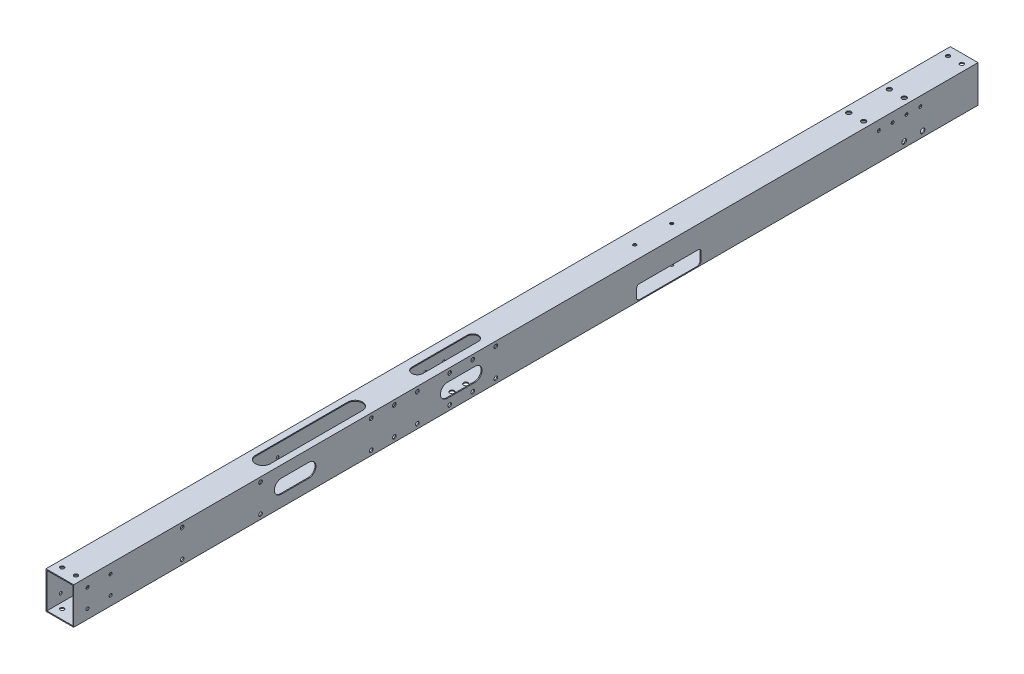
from build123d import *

# Parameters (mm, degrees)
SKETCH_1_W             = 30
SKETCH_1_H             = 40
SKETCH_1_W_2           = 28
SKETCH_1_H_2           = 38
EXTRUDE_1_DEPTH        = 940
SKETCH_5_R             = 2.5
CUT_EXTRUDE_3_DEPTH    = 941.97024395
CUT_EXTRUDE_4_DEPTH    = 1
SKETCH_7_R             = 1.5
CUT_EXTRUDE_5_DEPTH    = 1
SKETCH_17_W            = 30
SKETCH_17_H            = 40
SKETCH_17_W_2          = 28
SKETCH_17_H_2          = 38
EXTRUDE_2_DEPTH        = 20
SKETCH_18_W            = 30
SKETCH_18_H            = 40
SKETCH_18_W_2          = 28
SKETCH_18_H_2          = 38
EXTRUDE_3_DEPTH        = 20
SKETCH_19_R            = 2.1
CUT_EXTRUDE_16_DEPTH   = 961.950050731
SKETCH_20_R            = 1.6
CUT_EXTRUDE_17_DEPTH   = 961.67684473
SKETCH_21_R            = 2.5
SKETCH_21_R_2          = 1.6
CUT_EXTRUDE_18_DEPTH   = 961.67684473
SKETCH_23_R            = 2.5
CUT_EXTRUDE_19_DEPTH   = 961.950050731
SKETCH_24_R            = 4.5
CUT_EXTRUDE_20_DEPTH   = 10
SKETCH_26_R            = 2
CUT_EXTRUDE_22_DEPTH   = 961.67684473
CUT_EXTRUDE_28_DEPTH   = 10
PATTERN_LINEAR_4_COUNT = 2
PATTERN_LINEAR_4_PITCH = 255
PATTERN_LINEAR_8_COUNT = 2
PATTERN_LINEAR_8_PITCH = 205
PATTERN_LINEAR_9_COUNT = 2
PATTERN_LINEAR_9_PITCH = 230
CUT_EXTRUDE_START      = -20
SKETCH_34_R            = 1.75
CUT_EXTRUDE_29_DEPTH   = 20
SKETCH_35_R            = 1.5
CUT_EXTRUDE_30_DEPTH   = 10
CUT_EXTRUDE_31_DEPTH   = 10
SKETCH_37_R            = 1.65
CUT_EXTRUDE_32_DEPTH   = 52
SKETCH_39_R            = 1.75
CUT_EXTRUDE_33_DEPTH   = 10
SKETCH_40_W            = 70
SKETCH_40_H            = 15
CUT_EXTRUDE_34_DEPTH   = 10
EXTRUDE_5_DEPTH        = 1
SKETCH_43_W            = 38.522995696
SKETCH_43_H            = 13.00002022
EXTRUDE_6_DEPTH        = 1
FILLET_1_R             = 3


with BuildPart() as part:
    # 草图1 → 凸台-拉伸1 (new body)
    with BuildSketch(Plane.XY):
        Rectangle(SKETCH_1_W, SKETCH_1_H)
        Rectangle(SKETCH_1_W_2, SKETCH_1_H_2, mode=Mode.SUBTRACT)
    extrude(amount=EXTRUDE_1_DEPTH)

    # 草图5 → 切除-拉伸3 (cut, through all)
    with BuildSketch(Plane.XZ.offset(20)):
        with Locations((-8, 53)):
            Circle(SKETCH_5_R)
        with Locations((8, 53)):
            Circle(SKETCH_5_R)
        with Locations((-8, 97)):
            Circle(SKETCH_5_R)
        with Locations((8, 97)):
            Circle(SKETCH_5_R)
    extrude(amount=-CUT_EXTRUDE_3_DEPTH, mode=Mode.SUBTRACT)

    # 草图6 → 切除-拉伸4 (cut)
    with BuildSketch(Plane(origin=(15, 0, 0), x_dir=(0, 0, -1), z_dir=(1, 0, 0))):
        with BuildLine():
            Line((-345, -7.5), (-375, -7.5))
            ThreePointArc((-375, -7.5), (-382.5, 0), (-375, 7.5))
            Line((-375, 7.5), (-345, 7.5))
            ThreePointArc((-345, 7.5), (-337.5, 0), (-345, -7.5))
        make_face()
        with BuildLine():
            Line((-525, -7.5), (-555, -7.5))
            ThreePointArc((-555, -7.5), (-562.5, 0), (-555, 7.5))
            Line((-555, 7.5), (-525, 7.5))
            ThreePointArc((-525, 7.5), (-517.5, 0), (-525, -7.5))
        make_face()
        with BuildLine():
            Line((-705, -7.5), (-735, -7.5))
            ThreePointArc((-735, -7.5), (-742.5, 0), (-735, 7.5))
            Line((-735, 7.5), (-705, 7.5))
            ThreePointArc((-705, 7.5), (-697.5, 0), (-705, -7.5))
        make_face()
    extrude(amount=-CUT_EXTRUDE_4_DEPTH, mode=Mode.SUBTRACT)

    # 草图7 → 切除-拉伸5 (cut)
    with BuildSketch(Plane.ZY.offset(15)):
        with Locations((350, 0)):
            Circle(SKETCH_7_R)
        with Locations((370, 0)):
            Circle(SKETCH_7_R)
        with Locations((530, 0)):
            Circle(SKETCH_7_R)
        with Locations((550, 0)):
            Circle(SKETCH_7_R)
        with Locations((710, 0)):
            Circle(SKETCH_7_R)
        with Locations((730, 0)):
            Circle(SKETCH_7_R)
    extrude(amount=-CUT_EXTRUDE_5_DEPTH, mode=Mode.SUBTRACT)

    # 草图17 → 凸台-拉伸2 (add)
    with BuildSketch(Plane.XY.offset(940)):
        Rectangle(SKETCH_17_W, SKETCH_17_H)
        Rectangle(SKETCH_17_W_2, SKETCH_17_H_2, mode=Mode.SUBTRACT)
    extrude(amount=EXTRUDE_2_DEPTH)

    # 草图18 → 凸台-拉伸3 (add)
    with BuildSketch(Plane(origin=(0, 0, 0), x_dir=(-1, 0, 0), z_dir=(0, 0, -1))):
        Rectangle(SKETCH_18_W, SKETCH_18_H)
        Rectangle(SKETCH_18_W_2, SKETCH_18_H_2, mode=Mode.SUBTRACT)
    extrude(amount=EXTRUDE_3_DEPTH)

    # 草图19 → 切除-拉伸16 (cut, through all)
    with BuildSketch(Plane(origin=(0, 20, 0), x_dir=(1, 0, 0), z_dir=(0, 1, 0))):
        with Locations((-7.5, -950)):
            Circle(SKETCH_19_R)
        with Locations((7.5, -950)):
            Circle(SKETCH_19_R)
        with Locations((-7.5, 10)):
            Circle(SKETCH_19_R)
        with Locations((7.5, 10)):
            Circle(SKETCH_19_R)
    extrude(amount=-CUT_EXTRUDE_16_DEPTH, mode=Mode.SUBTRACT)

    # 草图20 → 切除-拉伸17 (cut, through all)
    with BuildSketch(Plane(origin=(15, 0, 0), x_dir=(0, 0, -1), z_dir=(1, 0, 0))):
        with Locations((-945, 10)):
            Circle(SKETCH_20_R)
        with Locations((-920, 10)):
            Circle(SKETCH_20_R)
        with Locations((-920, -10)):
            Circle(SKETCH_20_R)
        with Locations((-945, -10)):
            Circle(SKETCH_20_R)
    extrude(amount=-CUT_EXTRUDE_17_DEPTH, mode=Mode.SUBTRACT)

    # 草图21 → 切除-拉伸18 (cut, through all)
    with BuildSketch(Plane(origin=(15, 0, 0), x_dir=(0, 0, -1), z_dir=(1, 0, 0))):
        with Locations((-40, -14)):
            Circle(SKETCH_21_R)
        with Locations((-60, -14)):
            Circle(SKETCH_21_R)
        with Locations((-42.5, 10)):
            Circle(SKETCH_21_R_2)
        with Locations((-57.5, 10)):
            Circle(SKETCH_21_R_2)
        with Locations((-72.5, 10)):
            Circle(SKETCH_21_R_2)
        with Locations((-87.5, 10)):
            Circle(SKETCH_21_R_2)
    extrude(amount=-CUT_EXTRUDE_18_DEPTH, mode=Mode.SUBTRACT)

    # 草图23 → 切除-拉伸19 (cut, through all)
    with BuildSketch(Plane(origin=(0, 20, 0), x_dir=(1, 0, 0), z_dir=(0, 1, 0))):
        with Locations((0, -520)):
            Circle(SKETCH_23_R)
        with Locations((0, -535)):
            Circle(SKETCH_23_R)
        with Locations((0, -550)):
            Circle(SKETCH_23_R)
        with Locations((0, -565)):
            Circle(SKETCH_23_R)
    extrude(amount=-CUT_EXTRUDE_19_DEPTH, mode=Mode.SUBTRACT)

    # 草图24 → 切除-拉伸20 (cut)
    with BuildSketch(Plane(origin=(0, 20, 0), x_dir=(1, 0, 0), z_dir=(0, 1, 0))):
        with Locations((0, -520)):
            Circle(SKETCH_24_R)
        with Locations((0, -535)):
            Circle(SKETCH_24_R)
        with Locations((0, -550)):
            Circle(SKETCH_24_R)
        with Locations((0, -565)):
            Circle(SKETCH_24_R)
    extrude(amount=-CUT_EXTRUDE_20_DEPTH, mode=Mode.SUBTRACT)

    # 草图26 → 切除-拉伸22 (cut, through all)
    with BuildSketch(Plane(origin=(15, 0, 0), x_dir=(0, 0, -1), z_dir=(1, 0, 0))):
        with Locations((-842.5, 15)):
            Circle(SKETCH_26_R)
        with Locations((-842.5, -15)):
            Circle(SKETCH_26_R)
        with Locations((-757.5, -15)):
            Circle(SKETCH_26_R)
        with Locations((-757.5, 15)):
            Circle(SKETCH_26_R)
    cut_extrude_22 = extrude(amount=-CUT_EXTRUDE_22_DEPTH, mode=Mode.SUBTRACT)

    # 草图33 → 切除-拉伸28 (cut)
    with BuildSketch(Plane(origin=(0, 20, 0), x_dir=(1, 0, 0), z_dir=(0, 1, 0))):
        with BuildLine():
            Line((6, -512.5), (6, -572.5))
            ThreePointArc((6, -572.5), (0, -578.5), (-6, -572.5))
            Line((-6, -572.5), (-6, -512.5))
            ThreePointArc((-6, -512.5), (0, -506.5), (6, -512.5))
        make_face()
    extrude(amount=-CUT_EXTRUDE_28_DEPTH, mode=Mode.SUBTRACT)

    # 阵列(线性)4: 切除-拉伸22 ×2
    with Locations(*[(0, 0, -i * PATTERN_LINEAR_4_PITCH) for i in range(1, PATTERN_LINEAR_4_COUNT)]):
        add(cut_extrude_22, mode=Mode.SUBTRACT)

    # 阵列(线性)8: 切除-拉伸22 ×2
    with Locations(*[(0, 0, -i * PATTERN_LINEAR_8_PITCH) for i in range(1, PATTERN_LINEAR_8_COUNT)]):
        add(cut_extrude_22, mode=Mode.SUBTRACT)

    # 阵列(线性)9: 切除-拉伸22 ×2
    with Locations(*[(0, 0, -i * PATTERN_LINEAR_9_PITCH) for i in range(1, PATTERN_LINEAR_9_COUNT)]):
        add(cut_extrude_22, mode=Mode.SUBTRACT)

    # 草图34 → 切除-拉伸29 (cut)
    with BuildSketch(Plane(origin=(15, 0, 0), x_dir=(0, 0, -1), z_dir=(1, 0, 0)).offset(CUT_EXTRUDE_START)):
        with Locations((-935, 0)):
            Circle(SKETCH_34_R)
        with Locations((-915, 0)):
            Circle(SKETCH_34_R)
    extrude(amount=-CUT_EXTRUDE_29_DEPTH, mode=Mode.SUBTRACT)

    # 草图35 → 切除-拉伸30 (cut)
    with BuildSketch(Plane.XZ.offset(20)):
        with Locations((5, 720)):
            Circle(SKETCH_35_R)
        with Locations((5, 700)):
            Circle(SKETCH_35_R)
        with Locations((5, 680)):
            Circle(SKETCH_35_R)
        with Locations((5, 660)):
            Circle(SKETCH_35_R)
        with Locations((5, 640)):
            Circle(SKETCH_35_R)
        with Locations((5, 740)):
            Circle(SKETCH_35_R)
    extrude(amount=-CUT_EXTRUDE_30_DEPTH, mode=Mode.SUBTRACT)

    # 草图36 → 切除-拉伸31 (cut)
    with BuildSketch(Plane(origin=(0, 20, 0), x_dir=(1, 0, 0), z_dir=(0, 1, 0))):
        with BuildLine():
            Line((8, -640), (8, -740))
            ThreePointArc((8, -740), (0, -748), (-8, -740))
            Line((-8, -740), (-8, -640))
            ThreePointArc((-8, -640), (0, -632), (8, -640))
        make_face()
    extrude(amount=-CUT_EXTRUDE_31_DEPTH, mode=Mode.SUBTRACT)

    # 草图37 → 切除-拉伸32 (cut)
    with BuildSketch(Plane(origin=(0, 20, 0), x_dir=(1, 0, 0), z_dir=(0, 1, 0))):
        with Locations((0, -297)):
            Circle(SKETCH_37_R)
        with Locations((0, -337)):
            Circle(SKETCH_37_R)
    extrude(amount=-CUT_EXTRUDE_32_DEPTH, mode=Mode.SUBTRACT)

    # 草图39 → 切除-拉伸33 (cut)
    with BuildSketch(Plane.XZ.offset(20)):
        with Locations((0, 137)):
            Circle(SKETCH_39_R)
        with Locations((0, 177)):
            Circle(SKETCH_39_R)
    extrude(amount=-CUT_EXTRUDE_33_DEPTH, mode=Mode.SUBTRACT)

    # 草图40 → 切除-拉伸34 (cut)
    with BuildSketch(Plane(origin=(15, 0, 0), x_dir=(0, 0, -1), z_dir=(1, 0, 0))):
        with Locations((-315, -11.5)):
            Rectangle(SKETCH_40_W, SKETCH_40_H)
    extrude(amount=-CUT_EXTRUDE_34_DEPTH, mode=Mode.SUBTRACT)

    # 草图42 → 凸台-拉伸5 (add)
    with BuildSketch(Plane(origin=(15, 0, 0), x_dir=(0, 0, -1), z_dir=(1, 0, 0))):
        Polygon((-350, -8.24794841), (-350, -4), (-334.23295051, -4), (-334.23295051, 12.222841732), (-383.610977641, 12.222841732), (-383.610977641, -8.24794841), align=None)
    extrude(amount=-EXTRUDE_5_DEPTH)

    # 草图43 → 凸台-拉伸6 (add)
    with BuildSketch(Plane.ZY.offset(15)):
        with Locations((362.400416305, 1.435266839)):
            Rectangle(SKETCH_43_W, SKETCH_43_H)
    extrude(amount=-EXTRUDE_6_DEPTH)

    # 圆角1
    fillet_1_edges = [part.edges().sort_by_distance(p)[0] for p in [
        (14.5, -19, 280),
        (14.5, -4, 280),
        (14.5, -19, 350),
        (14.5, -4, 350),
    ]]
    fillet(fillet_1_edges, radius=FILLET_1_R)


solid = part.part
